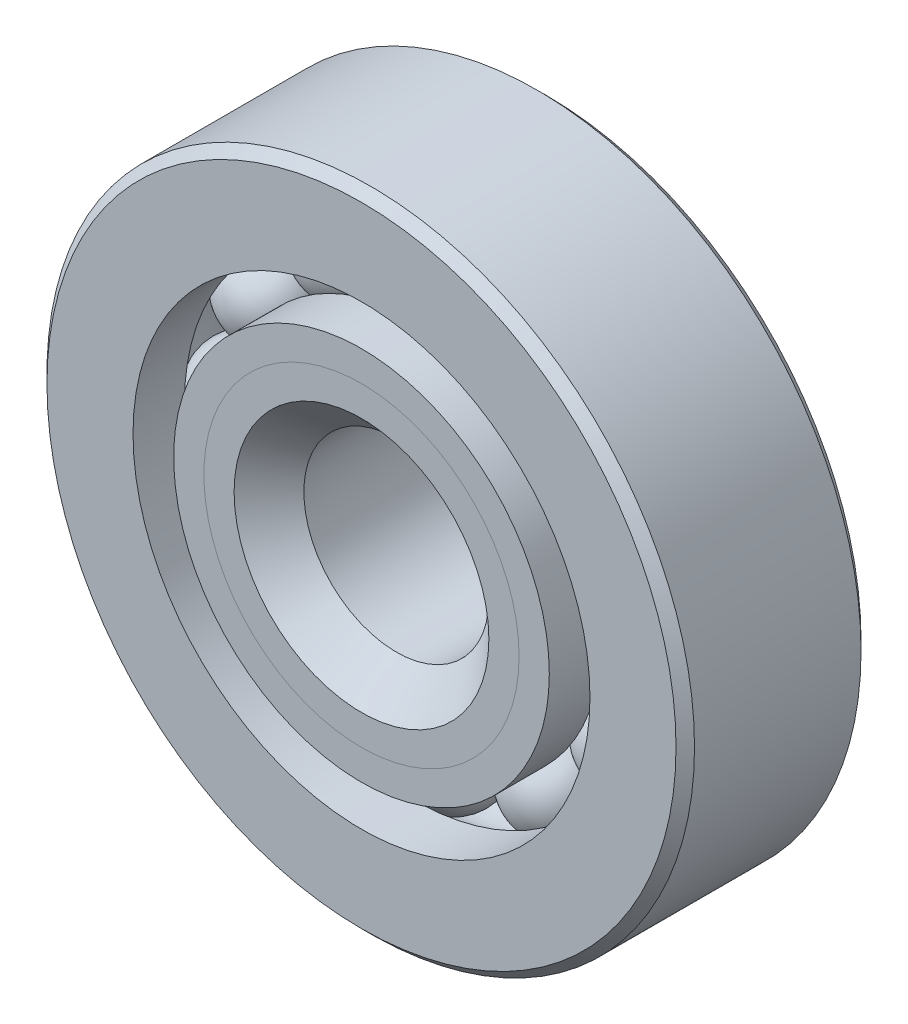
from build123d import *

# Parameters (mm, degrees)
CIRPATTERN1_COUNT = 12


with BuildPart() as part:
    # Sketch1 → Revolve1 (revolve)
    with BuildSketch(Plane(origin=(0, 0, 0), x_dir=(0, 0, -1), z_dir=(1, 0, 0))):
        with BuildLine():
            Line((2.8575, 11.1125), (-2.8575, 11.1125))
            Line((-2.8575, 11.1125), (-3.175, 10.795))
            Line((-3.175, 10.795), (-3.175, 7.841552198))
            Line((-3.175, 7.841552198), (-1.411111111, 7.841552198))
            ThreePointArc((-1.411111111, 7.841552198), (0, 8.717968052), (1.411111111, 7.841552198))
            Line((1.411111111, 7.841552198), (3.175, 7.841552198))
            Line((3.175, 7.841552198), (3.175, 10.795))
            Line((3.175, 10.795), (2.8575, 11.1125))
        make_face()
    revolve(axis=Axis((0, 0, 3.175), (0, 0, -1)))


with BuildPart() as body_2:
    # Sketch2 → Revolve2 (revolve)
    with BuildSketch(Plane(origin=(0, 0, 0), x_dir=(0, 0, -1), z_dir=(1, 0, 0))):
        with BuildLine():
            Line((-3.175, 6.445947802), (-1.411111111, 6.445947802))
            ThreePointArc((-1.411111111, 6.445947802), (-0.830562959, 5.806466318), (0, 5.569531948))
            Line((0, 5.569531948), (0, 4.372265974))
            Line((0, 4.372265974), (-2.138159086, 4.372265974))
            Line((-2.138159086, 4.372265974), (-3.175, 5.409106888))
            Line((-3.175, 5.409106888), (-3.175, 6.445947802))
        make_face()
    revolve(axis=Axis((0, 0, 3.175), (0, 0, -1)))


with BuildPart() as body_3:
    # Sketch3 → Revolve3 (revolve)
    with BuildSketch(Plane(origin=(0, 0, 0), x_dir=(0, 0, -1), z_dir=(1, 0, 0))):
        with BuildLine():
            Line((-3.175, 5.409106888), (-2.138159086, 4.372265974))
            Line((-2.138159086, 4.372265974), (0, 4.372265974))
            Line((0, 4.372265974), (0, 5.569531948))
            ThreePointArc((0, 5.569531948), (0.830562959, 5.806466318), (1.411111111, 6.445947802))
            Line((1.411111111, 6.445947802), (3.175, 6.445947802))
            Line((3.175, 6.445947802), (3.175, 3.4925))
            Line((3.175, 3.4925), (2.8575, 3.175))
            Line((2.8575, 3.175), (-1.977734026, 3.175))
            Line((-1.977734026, 3.175), (-3.175, 4.372265974))
            Line((-3.175, 4.372265974), (-3.175, 5.409106888))
        make_face()
    revolve(axis=Axis((0, 0, 3.175), (0, 0, -1)))


with BuildPart() as body_4:
    # Sketch4 → Revolve4 (revolve)
    with BuildSketch(Plane(origin=(0, 0, 0), x_dir=(0, 0, -1), z_dir=(1, 0, 0))):
        with BuildLine():
            Line((-1.574218052, 7.14375), (1.574218052, 7.14375))
            ThreePointArc((1.574218052, 7.14375), (0, 8.717968052), (-1.574218052, 7.14375))
        make_face()
    revolve(axis=Axis((0, 7.14375, 1.574218052), (0, 0, -1)))


with BuildPart() as cirpattern1_1:
    # CirPattern1: pattern copy
    add(body_4.part.rotate(Axis((0, 0, -3.175), (0, 0, 1)), 1 * 360 / CIRPATTERN1_COUNT))


with BuildPart() as cirpattern1_2:
    # CirPattern1: pattern copy
    add(body_4.part.rotate(Axis((0, 0, -3.175), (0, 0, 1)), 2 * 360 / CIRPATTERN1_COUNT))


with BuildPart() as cirpattern1_3:
    # CirPattern1: pattern copy
    add(body_4.part.rotate(Axis((0, 0, -3.175), (0, 0, 1)), 3 * 360 / CIRPATTERN1_COUNT))


with BuildPart() as cirpattern1_4:
    # CirPattern1: pattern copy
    add(body_4.part.rotate(Axis((0, 0, -3.175), (0, 0, 1)), 4 * 360 / CIRPATTERN1_COUNT))


with BuildPart() as cirpattern1_5:
    # CirPattern1: pattern copy
    add(body_4.part.rotate(Axis((0, 0, -3.175), (0, 0, 1)), 5 * 360 / CIRPATTERN1_COUNT))


with BuildPart() as cirpattern1_6:
    # CirPattern1: pattern copy
    add(body_4.part.rotate(Axis((0, 0, -3.175), (0, 0, 1)), 6 * 360 / CIRPATTERN1_COUNT))


with BuildPart() as cirpattern1_7:
    # CirPattern1: pattern copy
    add(body_4.part.rotate(Axis((0, 0, -3.175), (0, 0, 1)), 7 * 360 / CIRPATTERN1_COUNT))


with BuildPart() as cirpattern1_8:
    # CirPattern1: pattern copy
    add(body_4.part.rotate(Axis((0, 0, -3.175), (0, 0, 1)), 8 * 360 / CIRPATTERN1_COUNT))


with BuildPart() as cirpattern1_9:
    # CirPattern1: pattern copy
    add(body_4.part.rotate(Axis((0, 0, -3.175), (0, 0, 1)), 9 * 360 / CIRPATTERN1_COUNT))


with BuildPart() as cirpattern1_10:
    # CirPattern1: pattern copy
    add(body_4.part.rotate(Axis((0, 0, -3.175), (0, 0, 1)), 10 * 360 / CIRPATTERN1_COUNT))


with BuildPart() as cirpattern1_11:
    # CirPattern1: pattern copy
    add(body_4.part.rotate(Axis((0, 0, -3.175), (0, 0, 1)), 11 * 360 / CIRPATTERN1_COUNT))


solid = Compound([part.part, body_2.part, body_3.part, body_4.part, cirpattern1_1.part, cirpattern1_2.part, cirpattern1_3.part, cirpattern1_4.part, cirpattern1_5.part, cirpattern1_6.part, cirpattern1_7.part, cirpattern1_8.part, cirpattern1_9.part, cirpattern1_10.part, cirpattern1_11.part])
